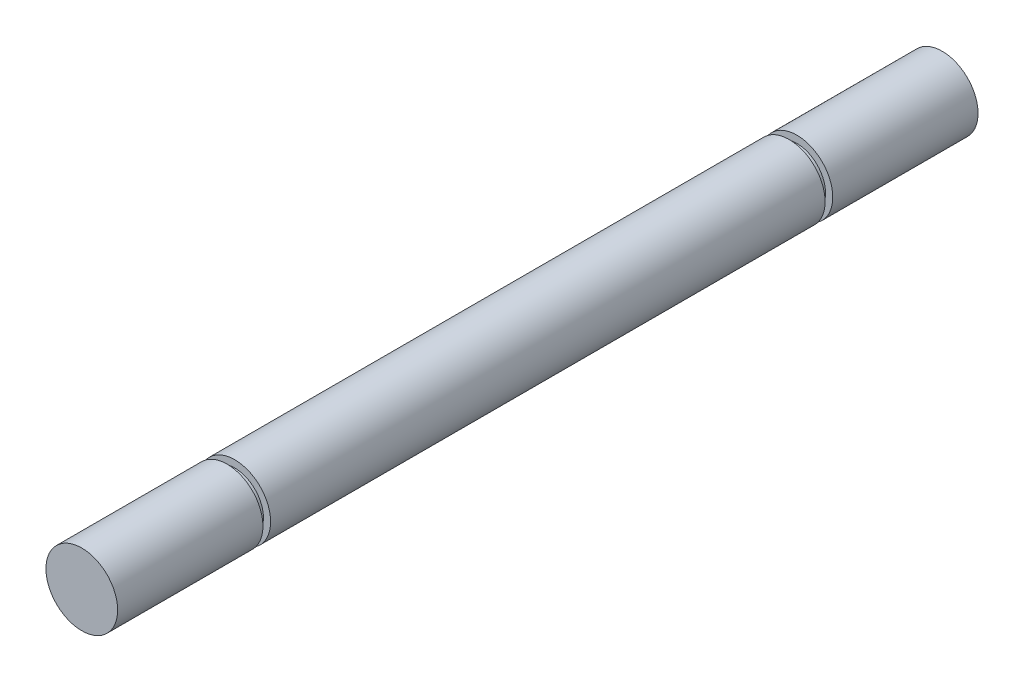
from build123d import *

# Parameters (mm, degrees)
SKETCH1_R           = 4.7625
BOSS_EXTRUDE1_DEPTH = 73.66
SKETCH2_R           = 3.81
BOSS_EXTRUDE2_DEPTH = 1.016
BOSS_EXTRUDE3_START = 19.304
SKETCH3_R           = 4.7625
BOSS_EXTRUDE3_DEPTH = 19.304
BOSS_EXTRUDE4_START = 1.016
SKETCH4_R           = 3.81
BOSS_EXTRUDE4_DEPTH = 1.016
SKETCH5_R           = 4.7625
BOSS_EXTRUDE5_DEPTH = 19.304


with BuildPart() as part:
    # Sketch1 → Boss-Extrude1 (new body)
    with BuildSketch(Plane.XY):
        Circle(SKETCH1_R)
    extrude(amount=BOSS_EXTRUDE1_DEPTH)

    # Sketch2 → Boss-Extrude2 (add)
    with BuildSketch(Plane(origin=(0, 0, 0), x_dir=(-1, 0, 0), z_dir=(0, 0, -1))):
        Circle(SKETCH2_R)
    extrude(amount=BOSS_EXTRUDE2_DEPTH)

    # Sketch3 → Boss-Extrude3 (add)
    with BuildSketch(Plane(origin=(0, 0, -1.016), x_dir=(-1, 0, 0), z_dir=(0, 0, -1)).offset(BOSS_EXTRUDE3_START)):
        Circle(SKETCH3_R)
    extrude(amount=-BOSS_EXTRUDE3_DEPTH)

    # Sketch4 → Boss-Extrude4 (add)
    with BuildSketch(Plane.XY.offset(73.66).offset(BOSS_EXTRUDE4_START)):
        Circle(SKETCH4_R)
    extrude(amount=-BOSS_EXTRUDE4_DEPTH)

    # Sketch5 → Boss-Extrude5 (add)
    with BuildSketch(Plane.XY.offset(74.676)):
        Circle(SKETCH5_R)
    extrude(amount=BOSS_EXTRUDE5_DEPTH)


solid = part.part
